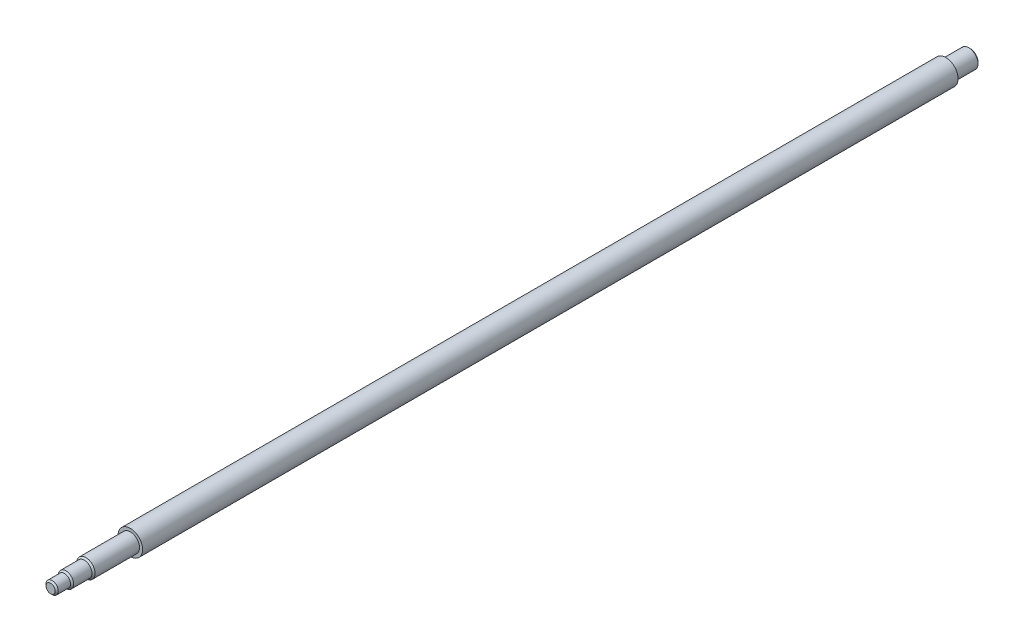
from build123d import *

# Parameters (mm, degrees)
SFAZOWANIE1_SIZE = 1
SFAZOWANIE2_SIZE = 1


with BuildPart() as part:
    # Szkic1 → Obrót1 (revolve)
    with BuildSketch(Plane(origin=(0, 0, 0), x_dir=(0, 0, -1), z_dir=(1, 0, 0)), mode=Mode.PRIVATE) as obr_t1_sk:
        Polygon((0, 0), (600, 0), (600, 6), (584, 6), (584, 8), (52, 8), (52, 6), (22, 6), (22, 5), (9, 5), (9, 4), (0, 4), align=None)
    revolve(obr_t1_sk.sketch.rotate(Axis((0, 0, 0), (0, 0, -1)), 90), axis=Axis((0, 0, 0), (0, 0, -1)))

    # Sfazowanie1
    sfazowanie1_edges = [part.edges().sort_by_distance(p)[0] for p in [
        (-6, 0, -22),
        (-4, 0, 0),
        (-5, 0, -9),
    ]]
    chamfer(sfazowanie1_edges, length=SFAZOWANIE1_SIZE - 0.0001)  # a hair under: the kernel refuses the full size

    # Sfazowanie2
    sfazowanie2_edges = [part.edges().sort_by_distance(p)[0] for p in [
        (-6, 0, -600),
    ]]
    chamfer(sfazowanie2_edges, length=SFAZOWANIE2_SIZE)


solid = part.part
